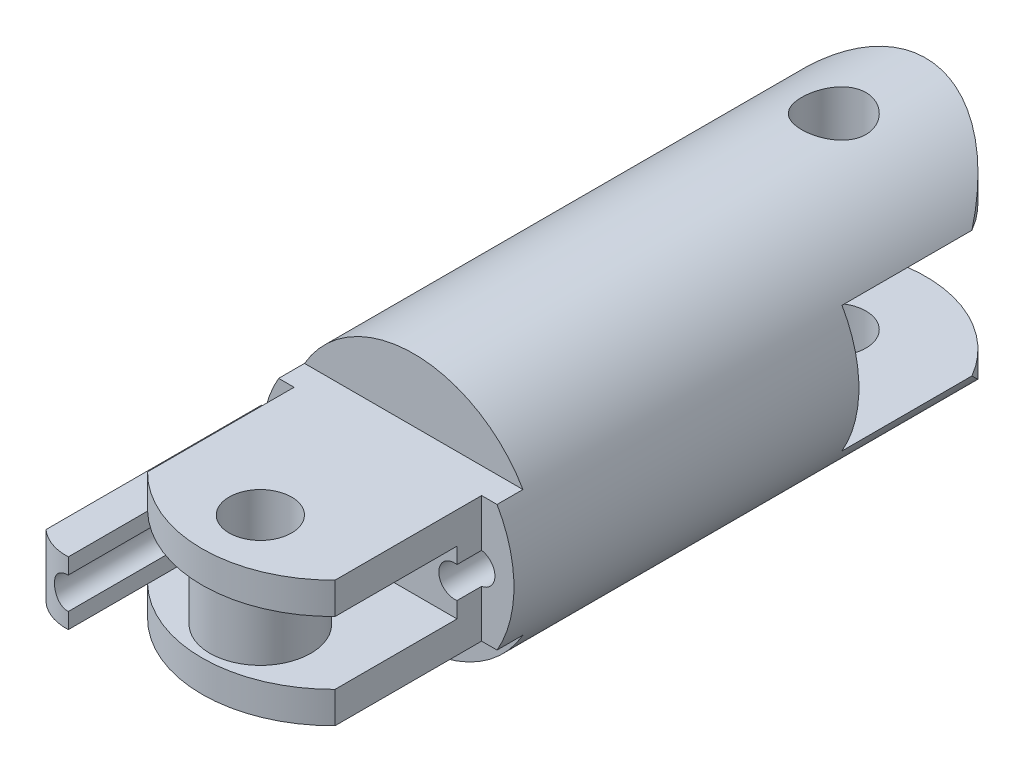
from build123d import *
from build123d.topology import SkipClean

# Parameters (mm, degrees)
SKETCH2_R                       = 10
PHALANGE_LENGTH_DEPTH           = 29.3
BOSS_EXTRUDE3_DEPTH             = 5
BOSS_EXTRUDE4_DEPTH             = 5
BOSS_EXTRUDE4_DEPTH_BACK        = 5
CUT_EXTRUDE2_START              = -15.3025
CUT_EXTRUDE2_DEPTH              = 15.3025
SKETCH7_R                       = 1.65
CUT_EXTRUDE3_DEPTH              = 10
CUT_EXTRUDE4_DEPTH              = 2.5
CUT_EXTRUDE4_DEPTH_BACK         = 2.5
CUT_EXTRUDE7_REACH              = 50.154
SKETCH4_R                       = 1.65
CUT_EXTRUDE7_DIRECTION_2_REACH  = 50.154
CUT_EXTRUDE_THIN1_START         = 29.3
CUT_EXTRUDE_THIN1_DEPTH         = 10.361670454
BOSS_EXTRUDE5_REACH             = 49.435
SKETCH9_R                       = 4
SKETCH9_R_2                     = 1.65
CUT_EXTRUDE8_REACH              = 48.791
SKETCH10_R                      = 1.25
CUT_EXTRUDE9_START              = -4
CUT_EXTRUDE9_DEPTH              = 4
CUT_EXTRUDE10_REACH             = 49.435
CUT_EXTRUDE10_DIRECTION_2_REACH = 49.435
CUT_EXTRUDE11_START             = -10
CUT_EXTRUDE11_OUTLINE_W         = 2.565773848
CUT_EXTRUDE11_OUTLINE_H         = 11.6166929
CUT_EXTRUDE11_DEPTH             = 10
BOSS_EXTRUDE7_REACH             = 47.032
CUT_EXTRUDE12_REACH             = 48.791
SKETCH10_2_R                    = 1.25
CUT_EXTRUDE12_DIRECTION_2_REACH = 48.791
SKETCH17_R                      = 1.25
SKETCH17_W                      = 2.42123439
SKETCH17_H                      = 5
CUT_EXTRUDE14_DEPTH             = 16.148519
SCALE1_SCALE                    = 0.666666667
CUT_EXTRUDE15_START             = -10
SKETCH18_R                      = 1.65
CUT_EXTRUDE15_DEPTH             = 13.333338
CUT_EXTRUDE16_START             = -3.333333
SKETCH19_R                      = 1.7
CUT_EXTRUDE16_DEPTH             = 13.333338


# Read off the part's stored shape, not the designer's step: Cut-Extrude-Thin1, Cut-Extrude11
with BuildPart() as part:
    # Sketch2 → Phalange Length (new body)
    with BuildSketch(Plane.XY):
        Circle(SKETCH2_R)
    extrude(amount=PHALANGE_LENGTH_DEPTH)

    # Sketch3 → Boss-Extrude3 (add)
    with BuildSketch(Plane(origin=(0, -10, 0), x_dir=(-1, 0, 0), z_dir=(0, -1, 0))):
        with BuildLine():
            Line((-10, 5.302499701), (-10, 0))
            Line((-10, 0), (10, 0))
            Line((10, 0), (10, 5.302499701))
            ThreePointArc((10, 5.302499701), (0, 15.302499701), (-10, 5.302499701))
        make_face()
    boss_extrude3 = extrude(amount=-BOSS_EXTRUDE3_DEPTH)

    # Mirror1: Boss-Extrude3 across plane
    add(boss_extrude3.mirror(Plane.ZX))

    # Sketch5 → Boss-Extrude4 (add, two sides: drawn at the far end of the back side and taken through both)
    with BuildSketch(Plane(origin=(0, 0, 0), x_dir=(1, 0, 0), z_dir=(0, 1, 0)).offset(-BOSS_EXTRUDE4_DEPTH_BACK)):
        with BuildLine():
            Line((-10, -35.083157911), (-10, -29.3))
            Line((-10, -29.3), (10, -29.3))
            Line((10, -29.3), (10, -35.083157911))
            ThreePointArc((10, -35.083157911), (0, -44.651984156), (-10, -35.083157911))
        make_face()
    extrude(amount=BOSS_EXTRUDE4_DEPTH + BOSS_EXTRUDE4_DEPTH_BACK)

    # Sketch6 → Cut-Extrude2 (cut)
    with SkipClean():  # the faces are left unmerged after this step: merging them gives an invalid solid
        with BuildSketch(Plane.XY.offset(CUT_EXTRUDE2_START)):
            with BuildLine():
                ThreePointArc((0, 10), (5, 8.660254038), (8.660254038, 5))
                Line((8.660254038, 5), (10, 5))
                Line((10, 5), (10, 10))
                Line((10, 10), (0, 10))
            make_face()
            with BuildLine():
                Line((10, -5), (8.660254038, -5))
                ThreePointArc((8.660254038, -5), (5, -8.660254038), (0, -10))
                Line((0, -10), (10, -10))
                Line((10, -10), (10, -5))
            make_face()
            with BuildLine():
                ThreePointArc((-8.660254038, 5), (-5, 8.660254038), (0, 10))
                Line((0, 10), (-10, 10))
                Line((-10, 10), (-10, 5))
                Line((-10, 5), (-8.660254038, 5))
            make_face()
            with BuildLine():
                Line((-10, -10), (0, -10))
                ThreePointArc((0, -10), (-5, -8.660254038), (-8.660254038, -5))
                Line((-8.660254038, -5), (-10, -5))
                Line((-10, -5), (-10, -10))
            make_face()
        extrude(amount=CUT_EXTRUDE2_DEPTH, mode=Mode.SUBTRACT)

    # Sketch7 → Cut-Extrude3 (cut)
    with SkipClean():  # the faces are left unmerged after this step: merging them gives an invalid solid
        with BuildSketch(Plane(origin=(0, 5, 0), x_dir=(1, 0, 0), z_dir=(0, 1, 0))):
            with Locations(Location((0, -37.461984156, 0), (0, 0, 270))):
                Circle(SKETCH7_R)
        extrude(amount=-CUT_EXTRUDE3_DEPTH, mode=Mode.SUBTRACT)

    # Sketch5<2> → Cut-Extrude4 (cut, two sides: drawn at the far end of the back side and taken through both)
    with BuildSketch(Plane(origin=(0, 0, 0), x_dir=(1, 0, 0), z_dir=(0, 1, 0)).offset(-CUT_EXTRUDE4_DEPTH_BACK)):
        with BuildLine():
            Line((-10, -35.083157911), (-10, -29.3))
            Line((-10, -29.3), (10, -29.3))
            Line((10, -29.3), (10, -35.083157911))
            ThreePointArc((10, -35.083157911), (0, -44.651984156), (-10, -35.083157911))
        make_face()
    extrude(amount=CUT_EXTRUDE4_DEPTH + CUT_EXTRUDE4_DEPTH_BACK, mode=Mode.SUBTRACT)

    # Sketch4 → Cut-Extrude7 (cut, up to next)
    with BuildSketch(Plane(origin=(0, -5, 0), x_dir=(1, 0, 0), z_dir=(0, 1, 0)), mode=Mode.PRIVATE) as cut_extrude7_sk1:
        with Locations(Location((0, 8.010159673, 0), (0, 0, 270))):
            Circle(SKETCH4_R)
    cut_extrude7_tool1 = extrude(cut_extrude7_sk1.sketch, amount=-CUT_EXTRUDE7_REACH, mode=Mode.PRIVATE) & part.part
    add(cut_extrude7_tool1.solids().sort_by_distance((0, -5, -8.01016))[0], mode=Mode.SUBTRACT)

    # Sketch4 → Cut-Extrude7 direction 2 (cut, up to next)
    with BuildSketch(Plane(origin=(0, -5, 0), x_dir=(1, 0, 0), z_dir=(0, 1, 0)), mode=Mode.PRIVATE) as cut_extrude7_direction_2_sk1:
        with Locations(Location((0, 8.010159673, 0), (0, 0, 270))):
            Circle(SKETCH4_R)
    cut_extrude7_direction_2_tool1 = extrude(cut_extrude7_direction_2_sk1.sketch, amount=CUT_EXTRUDE7_DIRECTION_2_REACH, mode=Mode.PRIVATE) & part.part
    add(cut_extrude7_direction_2_tool1.solids().sort_by_distance((0, -5, -8.01016))[0], mode=Mode.SUBTRACT)

    # Cut-Extrude-Thin1 outline → Cut-Extrude-Thin1 (cut)
    with SkipClean():  # the faces are left unmerged after this step: merging them gives an invalid solid
        with BuildSketch(Plane.XY.offset(CUT_EXTRUDE_THIN1_START)):
            with BuildLine():
                ThreePointArc((8.660254038, 5), (9.256147934, 3.78466979), (9.682458366, 2.5))
                Line((9.682458366, 2.5), (10, 2.5))
                Line((10, 2.5), (10, 5))
                Line((10, 5), (8.660254038, 5))
            make_face()
            with BuildLine():
                Line((10, -2.5), (9.682458366, -2.5))
                ThreePointArc((9.682458366, -2.5), (9.256147934, -3.78466979), (8.660254038, -5))
                Line((8.660254038, -5), (10, -5))
                Line((10, -5), (10, -2.5))
            make_face()
            with BuildLine():
                Line((-10, 2.5), (-9.682458366, 2.5))
                ThreePointArc((-9.682458366, 2.5), (-9.256147934, 3.78466979), (-8.660254038, 5))
                Line((-8.660254038, 5), (-10, 5))
                Line((-10, 5), (-10, 2.5))
            make_face()
            with BuildLine():
                ThreePointArc((-8.660254038, -5), (-9.256147934, -3.78466979), (-9.682458366, -2.5))
                Line((-9.682458366, -2.5), (-10, -2.5))
                Line((-10, -2.5), (-10, -5))
                Line((-10, -5), (-8.660254038, -5))
            make_face()
        extrude(amount=CUT_EXTRUDE_THIN1_DEPTH, mode=Mode.SUBTRACT)

    # Sketch9 → Boss-Extrude5 (add, up to next)
    with BuildSketch(Plane.XZ.offset(-2.5), mode=Mode.PRIVATE) as boss_extrude5_sk1:
        with Locations(Location((0, 37.461984156, 0), (0, 0, 90))):
            Circle(SKETCH9_R)
        with Locations(Location((0, 37.461984156, 0), (0, 0, 90))):
            Circle(SKETCH9_R_2, mode=Mode.SUBTRACT)
    boss_extrude5_tool1 = extrude(boss_extrude5_sk1.sketch, amount=BOSS_EXTRUDE5_REACH, mode=Mode.PRIVATE) - part.part
    add(boss_extrude5_tool1.solids().sort_by_distance((0, 2.5, 33.575121))[0])

    # Sketch10 → Cut-Extrude8 (cut, up to next)
    with BuildSketch(Plane.XY.offset(29.3), mode=Mode.PRIVATE) as cut_extrude8_sk1:
        with Locations((7.239961745, 0)):
            Circle(SKETCH10_R)
    cut_extrude8_tool1 = extrude(cut_extrude8_sk1.sketch, amount=-CUT_EXTRUDE8_REACH, mode=Mode.PRIVATE) & part.part
    # Sketch10 → Cut-Extrude8 (cut, up to next)
    with BuildSketch(Plane.XY.offset(29.3), mode=Mode.PRIVATE) as cut_extrude8_sk2:
        with Locations((-7.239961745, 0)):
            Circle(SKETCH10_R)
    cut_extrude8_tool2 = extrude(cut_extrude8_sk2.sketch, amount=-CUT_EXTRUDE8_REACH, mode=Mode.PRIVATE) & part.part
    add(cut_extrude8_tool1.solids().sort_by_distance((7.239962, 0, 29.3))[0], mode=Mode.SUBTRACT)
    add(cut_extrude8_tool2.solids().sort_by_distance((-7.239962, 0, 29.3))[0], mode=Mode.SUBTRACT)

    # Sketch11 → Cut-Extrude9 (cut)
    with SkipClean():  # the faces are left unmerged after this step: merging them gives an invalid solid
        with BuildSketch(Plane.XY.offset(29.3).offset(CUT_EXTRUDE9_START)):
            with BuildLine():
                ThreePointArc((8.660254038, 5), (0, 10), (-8.660254038, 5))
                Line((-8.660254038, 5), (8.660254038, 5))
            make_face()
            with BuildLine():
                Line((8.660254038, -5), (-8.660254038, -5))
                ThreePointArc((-8.660254038, -5), (0, -10), (8.660254038, -5))
            make_face()
        extrude(amount=CUT_EXTRUDE9_DEPTH, mode=Mode.SUBTRACT)

    # Sketch12 → Cut-Extrude10 (cut, up to next)
    with BuildSketch(Plane.XZ.offset(-2.5), mode=Mode.PRIVATE) as cut_extrude10_sk1:
        with BuildLine():
            Line((-10.033719202, 44.651984156), (-10.033719202, 37.464892021))
            Line((-10.033719202, 37.464892021), (-8.660254038, 37.464892021))
            ThreePointArc((-8.660254038, 37.464892021), (0, 42.090740593), (8.660254038, 37.464892021))
            Line((8.660254038, 37.464892021), (10.033719202, 37.464892021))
            Line((10.033719202, 37.464892021), (10.033719202, 44.651984156))
            Line((10.033719202, 44.651984156), (-10.033719202, 44.651984156))
        make_face()
    cut_extrude10_tool1 = extrude(cut_extrude10_sk1.sketch, amount=CUT_EXTRUDE10_REACH, mode=Mode.PRIVATE) & part.part
    add(cut_extrude10_tool1.solids().sort_by_distance((0, 2.5, 42.150279))[0], mode=Mode.SUBTRACT)

    # Sketch12 → Cut-Extrude10 direction 2 (cut, up to next)
    with BuildSketch(Plane.XZ.offset(-2.5), mode=Mode.PRIVATE) as cut_extrude10_direction_2_sk1:
        with BuildLine():
            Line((-10.033719202, 44.651984156), (-10.033719202, 37.464892021))
            Line((-10.033719202, 37.464892021), (-8.660254038, 37.464892021))
            ThreePointArc((-8.660254038, 37.464892021), (0, 42.090740593), (8.660254038, 37.464892021))
            Line((8.660254038, 37.464892021), (10.033719202, 37.464892021))
            Line((10.033719202, 37.464892021), (10.033719202, 44.651984156))
            Line((10.033719202, 44.651984156), (-10.033719202, 44.651984156))
        make_face()
    cut_extrude10_direction_2_tool1 = extrude(cut_extrude10_direction_2_sk1.sketch, amount=-CUT_EXTRUDE10_DIRECTION_2_REACH, mode=Mode.PRIVATE) & part.part
    add(cut_extrude10_direction_2_tool1.solids().sort_by_distance((0, 2.5, 42.150279))[0], mode=Mode.SUBTRACT)

    # Cut-Extrude11 outline → Cut-Extrude11 (cut)
    with BuildSketch(Plane.XZ.offset(5).offset(CUT_EXTRUDE11_START)):
        with Locations((-8.717113076, 33.160571369)):
            Rectangle(CUT_EXTRUDE11_OUTLINE_W, CUT_EXTRUDE11_OUTLINE_H)
        with Locations((8.717113076, 33.160571369)):
            Rectangle(CUT_EXTRUDE11_OUTLINE_W, CUT_EXTRUDE11_OUTLINE_H)
    extrude(amount=CUT_EXTRUDE11_DEPTH, mode=Mode.SUBTRACT)

    # Boss-Extrude7: up to this face of the body (flat: up to its plane)
    boss_extrude7_end = Plane(part.part.faces().sort_by_distance((0, 2.5, 29.496174341))[0])
    # Sketch16 → Boss-Extrude7 (add, up to the picked face)
    with BuildSketch(Plane(origin=(0, -2.5, 0), x_dir=(1, 0, 0), z_dir=(0, 1, 0)), mode=Mode.PRIVATE) as boss_extrude7_sk1:
        with BuildLine():
            Line((-4.818727355, -27.352224919), (-7.434226152, -27.352224919))
            Line((-7.434226152, -27.352224919), (-10, -27.352224919))
            Line((-10, -27.352224919), (-10, -44.458561033))
            ThreePointArc((-10, -44.458561033), (-8.808295471, -45.190817912), (-7.43422564, -45.452145139))
            ThreePointArc((-7.43422564, -45.452145139), (-6.033645007, -45.199721533), (-4.818727355, -44.458561033))
            Line((-4.818727355, -44.458561033), (-4.818727355, -40.909527951))
            ThreePointArc((-4.818727355, -40.909527951), (-6.204248493, -40.042230104), (-7.437080645, -38.968917819))
            Line((-7.437080645, -38.968917819), (-7.434226152, -38.968917819))
            Line((-7.434226152, -38.968917819), (-7.434226152, -29.3))
            Line((-7.434226152, -29.3), (-4.818727355, -29.3))
            Line((-4.818727355, -29.3), (-4.818727355, -27.352224919))
        make_face()
    boss_extrude7_tool1 = split(extrude(boss_extrude7_sk1.sketch, amount=BOSS_EXTRUDE7_REACH, mode=Mode.PRIVATE), bisect_by=boss_extrude7_end, keep=Keep.BOTH, mode=Mode.PRIVATE)
    # Sketch16 → Boss-Extrude7 (add, up to the picked face)
    with BuildSketch(Plane(origin=(0, -2.5, 0), x_dir=(1, 0, 0), z_dir=(0, 1, 0)), mode=Mode.PRIVATE) as boss_extrude7_sk2:
        with BuildLine():
            Line((-4.818727355, -40.909527951), (-4.818727355, -29.3))
            Line((-4.818727355, -29.3), (-7.434226152, -29.3))
            Line((-7.434226152, -29.3), (-7.434226152, -38.968917819))
            Line((-7.434226152, -38.968917819), (-7.437080645, -38.968917819))
            ThreePointArc((-7.437080645, -38.968917819), (-6.204248493, -40.042230104), (-4.818727355, -40.909527951))
        make_face()
    boss_extrude7_tool2 = split(extrude(boss_extrude7_sk2.sketch, amount=BOSS_EXTRUDE7_REACH, mode=Mode.PRIVATE), bisect_by=boss_extrude7_end, keep=Keep.BOTH, mode=Mode.PRIVATE)
    add(boss_extrude7_tool1.solids().sort_by(Axis((-7.989429, -2.5, 36.933344), (0, 1, 0)))[0])
    add(boss_extrude7_tool2.solids().sort_by(Axis((-6.08748, -2.5, 34.6879), (0, 1, 0)))[0])

    # Sketch10<2> → Cut-Extrude12 (cut, up to next)
    with BuildSketch(Plane.XY.offset(29.3), mode=Mode.PRIVATE) as cut_extrude12_sk1:
        with Locations((-7.239961745, 0)):
            Circle(SKETCH10_2_R)
    cut_extrude12_tool1 = extrude(cut_extrude12_sk1.sketch, amount=CUT_EXTRUDE12_REACH, mode=Mode.PRIVATE) & part.part
    add(cut_extrude12_tool1.solids().sort_by_distance((-7.239962, 0, 29.3))[0], mode=Mode.SUBTRACT)

    # Sketch10<2> → Cut-Extrude12 direction 2 (cut, up to next)
    with BuildSketch(Plane.XY.offset(29.3), mode=Mode.PRIVATE) as cut_extrude12_direction_2_sk1:
        with Locations((-7.239961745, 0)):
            Circle(SKETCH10_2_R)
    cut_extrude12_direction_2_tool1 = extrude(cut_extrude12_direction_2_sk1.sketch, amount=-CUT_EXTRUDE12_DIRECTION_2_REACH, mode=Mode.PRIVATE) & part.part
    add(cut_extrude12_direction_2_tool1.solids().sort_by_distance((-7.239962, 0, 29.3))[0], mode=Mode.SUBTRACT)

    # Sketch17 → Cut-Extrude14 (cut)
    with SkipClean():  # the faces are left unmerged after this step: merging them gives an invalid solid
        with BuildSketch(Plane.XY.offset(29.3)):
            with Locations((-7.239961745, 0)):
                Circle(SKETCH17_R)
            with Locations((-6.02934455, 0)):
                Rectangle(SKETCH17_W, SKETCH17_H)
        extrude(amount=CUT_EXTRUDE14_DEPTH, mode=Mode.SUBTRACT)


with BuildPart() as part_1:
    # Scale1: scaled about (-0.156357219, -1.47e-07, 13.069731507)
    add(part.part.scale(SCALE1_SCALE).moved(Location((-0.052119073, -4.9e-08, 4.356577169))))

    # Sketch18 → Cut-Extrude15 (cut)
    with BuildSketch(Plane(origin=(0, 3.333328625, 0), x_dir=(1, 0, 0), z_dir=(0, 1, 0)).offset(CUT_EXTRUDE15_START)):
        with Locations(Location((-0.052127481, -29.331401561, 0), (0, 0, 270))):
            Circle(SKETCH18_R)
    extrude(amount=CUT_EXTRUDE15_DEPTH, mode=Mode.SUBTRACT)

    # Sketch19 → Cut-Extrude16 (cut)
    with BuildSketch(Plane(origin=(0, -3.333338042, 0), x_dir=(1, 0, 0), z_dir=(0, 1, 0)).offset(CUT_EXTRUDE16_START)):
        with Locations(Location((-0.052127481, 0.983360992, 0), (0, 0, 90))):
            Circle(SKETCH19_R)
    extrude(amount=CUT_EXTRUDE16_DEPTH, mode=Mode.SUBTRACT)


solid = part_1.part
